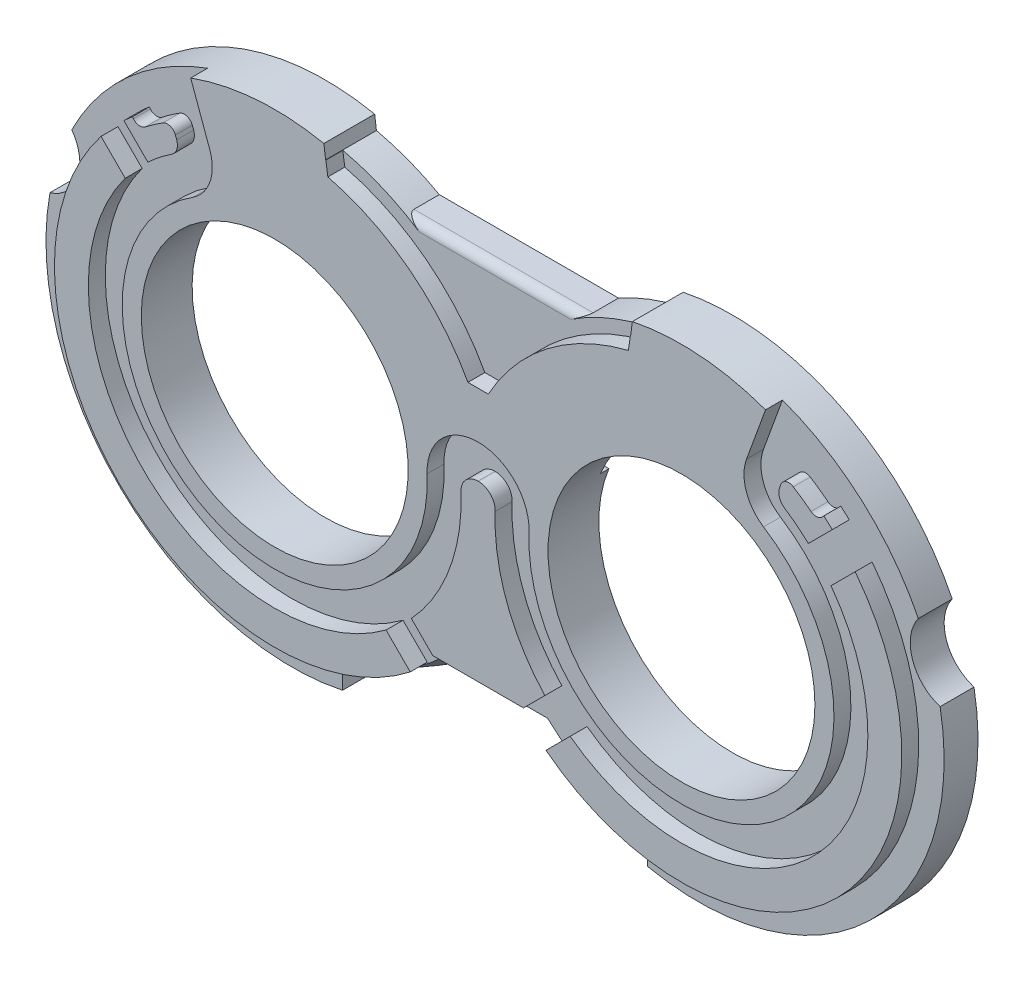
from build123d import *
from OCP.BRepFilletAPI import BRepFilletAPI_MakeChamfer

# Parameters (mm, degrees)
ESQUISSE1_R             = 15.75
BASE_EXTRUSION_DEPTH    = 6
ESQUISSE3_OUTSIDE_W     = 70.76
ESQUISSE3_OUTSIDE_H     = 75.76
ENL_V_MAT_EXTRU_1_DEPTH = 2
ENL_V_MAT_EXTRU_2_DEPTH = 2
CHANFREIN2_SIZE         = 3.75
CHANFREIN2_SIZE2        = 1.364888378
CONG_3_R                = 1
ESQUISSE5_W             = 32
ESQUISSE5_H             = 4
ENL_V_MAT_EXTRU_3_DEPTH = 1
ENL_V_MAT_EXTRU_4_DEPTH = 0.5


with BuildPart() as part:
    # Esquisse1 → Base-Extrusion (new body)
    with BuildSketch(Plane.XY):
        with BuildLine():
            Line((0, 24), (10.574278418, 24))
            ThreePointArc((10.574278418, 24), (14.184070134, 25.688470582), (18, 26.837473801))
            Line((18, 26.837473801), (18.203912889, 28.414879451))
            ThreePointArc((18.203912889, 28.414879451), (36.707137746, 26.067770336), (49.954076208, 12.937771377))
            ThreePointArc((49.954076208, 12.937771377), (49.25658351, 8.41886117), (52.525923792, 5.222228623))
            ThreePointArc((52.525923792, 5.222228623), (44.223899887, -20.784462306), (18, -28.372521918))
            Line((18, -28.372521918), (18, -26.837473801))
            ThreePointArc((18, -26.837473801), (11.428929963, -24.458499507), (5.66969722, -20.5))
            Line((5.66969722, -20.5), (0, -20.5))
            Line((0, -20.5), (0, 24))
        make_face()
        with Locations((24, 0)):
            Circle(ESQUISSE1_R, mode=Mode.SUBTRACT)
    extrude(amount=BASE_EXTRUSION_DEPTH)

    # Esquisse3 outside → Enlèv. mat.-Extru.1 (cut)
    with BuildSketch(Plane.XY.offset(6)):
        with Locations((26.5, 0)):
            Rectangle(ESQUISSE3_OUTSIDE_W, ESQUISSE3_OUTSIDE_H)
        with BuildLine():
            Line((0, 12.5), (0, -20.5))
            Line((0, -20.5), (8.007814408, -20.5))
            ThreePointArc((8.007814408, -20.5), (46.744727708, -12.596720266), (32.892523726, 24.43200814))
            Line((32.892523726, 24.43200814), (33.918584156, 27.251086003))
            ThreePointArc((33.918584156, 27.251086003), (26.141809812, 28.920799621), (18.203912889, 28.414879451))
            Line((18.203912889, 28.414879451), (17.731050851, 25.232920492))
            ThreePointArc((17.731050851, 25.232920492), (8.133239761, 20.59723087), (1.20197377, 12.5))
            Line((1.20197377, 12.5), (0, 12.5))
        make_face(mode=Mode.SUBTRACT)
    extrude(amount=-ENL_V_MAT_EXTRU_1_DEPTH, mode=Mode.SUBTRACT)

    # Esquisse4 → Enlèv. mat.-Extru.2 (cut)
    with BuildSketch(Plane.XY.offset(6)):
        with BuildLine():
            Line((0, 7), (0.020842383, 7))
            ThreePointArc((0.020842383, 7), (4.350969402, 5.153311931), (6.015631788, 0.75))
            ThreePointArc((6.015631788, 0.75), (32.319294254, -15.962122137), (33.686188392, 15.171610147))
            ThreePointArc((33.686188392, 15.171610147), (31.641362763, 17.781057074), (31.678333174, 21.096047015))
            Line((31.678333174, 21.096047015), (32.892523726, 24.43200814))
            ThreePointArc((32.892523726, 24.43200814), (37.046223912, 22.489909774), (40.794160069, 19.848329592))
            Line((40.794160069, 19.848329592), (40.677657876, 19.706070444))
            ThreePointArc((40.677657876, 19.706070444), (40.014260634, 19.345759586), (39.288017652, 19.551892907))
            ThreePointArc((39.288017652, 19.551892907), (38.260593052, 20.313431168), (37.195305146, 21.021035229))
            ThreePointArc((37.195305146, 21.021035229), (36.339050842, 21.119924861), (35.72395853, 20.516093727))
            Line((35.72395853, 20.516093727), (35.573013911, 20.101376794))
            ThreePointArc((35.573013911, 20.101376794), (35.55785996, 19.119038373), (36.153879256, 18.338026585))
            ThreePointArc((36.153879256, 18.338026585), (37.607804142, 17.286632594), (38.971216693, 16.120256534))
            Line((38.971216693, 16.120256534), (41.801277392, 18.950317233))
            ThreePointArc((41.801277392, 18.950317233), (43.207670295, 17.523281709), (44.5, 15.992185592))
            Line((44.5, 15.992185592), (41.646109851, 13.138295442))
            ThreePointArc((41.646109851, 13.138295442), (39.556349186, -15.556349186), (10.861704558, -17.646109851))
            Line((10.861704558, -17.646109851), (8.007814408, -20.5))
            Line((8.007814408, -20.5), (0, -20.5))
            Line((0, -20.5), (0, -17.5))
            Line((0, -17.5), (5.350960159, -17.5))
            Line((5.350960159, -17.5), (7.879743466, -14.971216693))
            ThreePointArc((7.879743466, -14.971216693), (3.359490399, -7.613761449), (2.019105518, 0.916666667))
            ThreePointArc((2.019105518, 0.916666667), (1.464218056, 2.38443731), (0.020842383, 3))
            Line((0.020842383, 3), (0, 3))
            Line((0, 3), (0, 7))
        make_face()
    extrude(amount=-ENL_V_MAT_EXTRU_2_DEPTH, mode=Mode.SUBTRACT)

    # Chanfrein2: one chamfer whose edges measure the first distance from different faces: ONE call of the kernel's chamfer builder (chamfer() names one face for all edges)
    chanfrein2_edges_1 = [part.edges().sort_by_distance(p)[0] for p in [
        (11.428929963, -24.458499507, 4),
    ]]
    chanfrein2_side_1 = [part.faces().sort_by_distance(p)[0] for p in [
        (11.428929963, -24.458499507, 2),
    ]]
    chanfrein2_edges_2 = [part.edges().sort_by_distance(p)[0] for p in [
        (2.83484861, -20.5, 4),
    ]]
    chanfrein2_side_2 = [part.faces().sort_by_distance(p)[0] for p in [
        (2.83484861, -20.5, 2),
    ]]
    chanfrein2 = BRepFilletAPI_MakeChamfer(part.part.solid().wrapped)
    for e in chanfrein2_edges_1:
        chanfrein2.Add(CHANFREIN2_SIZE, CHANFREIN2_SIZE2, e.wrapped, chanfrein2_side_1[0].wrapped)  # the first distance lies on this face
    for e in chanfrein2_edges_2:
        chanfrein2.Add(CHANFREIN2_SIZE, CHANFREIN2_SIZE2, e.wrapped, chanfrein2_side_2[0].wrapped)  # the first distance lies on this face
    add(Compound.cast(chanfrein2.Shape()), mode=Mode.REPLACE)

    # Congé3
    cong_3_edges = [part.edges().sort_by_distance(p)[0] for p in [
        (5.287139209, 24, 4),
    ]]
    fillet(cong_3_edges, radius=CONG_3_R)

    # Esquisse5 → Enlèv. mat.-Extru.3 (cut)
    with BuildSketch(Plane(origin=(0, 0, 0), x_dir=(-1, 0, 0), z_dir=(0, 0, -1))):
        with BuildLine():
            Line((0, -20.5), (-6, -20.5))
            Line((-6, -20.5), (-6, -7.5))
            ThreePointArc((-6, -7.5), (-5.707106781, -6.792893219), (-5, -6.5))
            Line((-5, -6.5), (0, -6.5))
            Line((0, -6.5), (0, -20.5))
        make_face()
        with Locations((-4, 8)):
            Rectangle(ESQUISSE5_W, ESQUISSE5_H)
    extrude(amount=-ENL_V_MAT_EXTRU_3_DEPTH, mode=Mode.SUBTRACT)

    # Esquisse6 → Enlèv. mat.-Extru.4 (cut)
    with BuildSketch(Plane(origin=(0, 0, 1), x_dir=(-1, 0, 0), z_dir=(0, 0, -1))):
        with BuildLine():
            Line((0, -20.227022324), (-5, -20.227022324))
            Line((-5, -20.227022324), (-5, -7.727022324))
            ThreePointArc((-5, -7.727022324), (-4.853553391, -7.373468934), (-4.5, -7.227022324))
            Line((-4.5, -7.227022324), (0, -7.227022324))
            Line((0, -7.227022324), (0, -20.227022324))
        make_face()
    extrude(amount=-ENL_V_MAT_EXTRU_4_DEPTH, mode=Mode.SUBTRACT)

    # Bossage-Symétrie1: part across plane


with BuildPart() as part_1:
    add(part.part)
    add(part.part.mirror(Plane(origin=(0, 24, 6), x_dir=(0, 0, 1), z_dir=(1, 0, 0))))


solid = part_1.part
